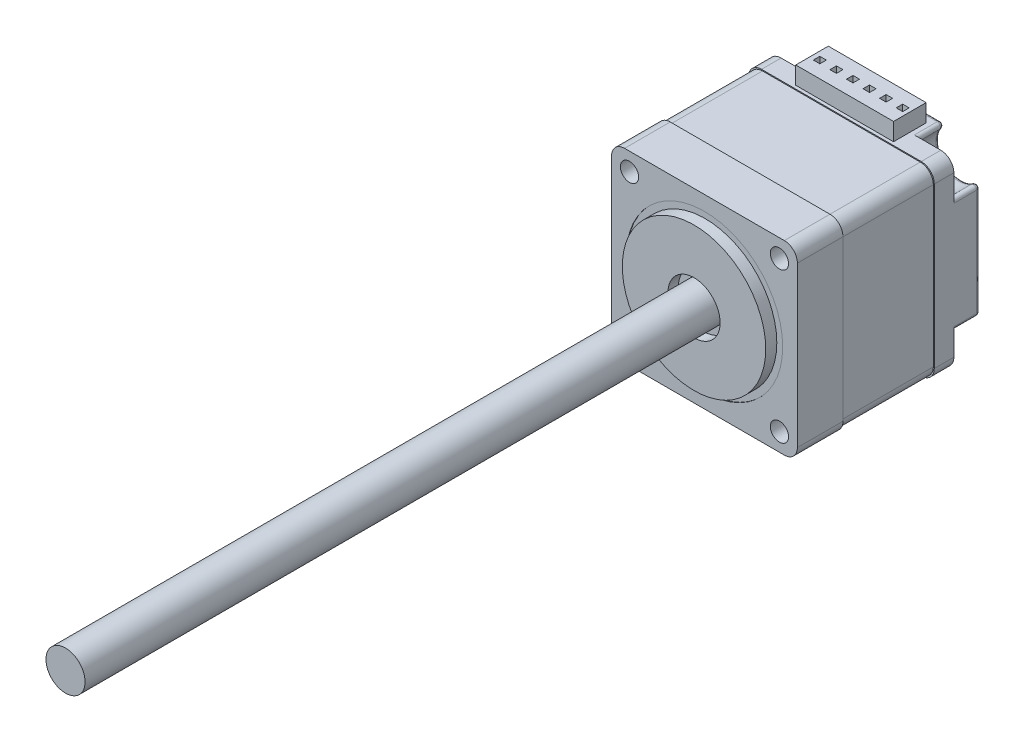
from build123d import *

# Parameters (mm, degrees)
SKETCH1_W           = 28.5
SKETCH1_H           = 28.5
BOSS_EXTRUDE1_DEPTH = 7
FILLET1_R           = 2
SKETCH2_R           = 11
BOSS_EXTRUDE2_DEPTH = 1.6
SKETCH3_R           = 4
CUT_EXTRUDE1_DEPTH  = 1.6
SKETCH6_W           = 28.2
SKETCH6_H           = 28.2
BOSS_EXTRUDE4_DEPTH = 14
FILLET2_R           = 2
SKETCH7_W           = 28.5
SKETCH7_H           = 28.5
BOSS_EXTRUDE5_DEPTH = 7
FILLET3_R           = 2
SKETCH8_W           = 15
SKETCH8_H           = 5
BOSS_EXTRUDE6_DEPTH = 2.7
SKETCH9_R           = 1.4
CUT_EXTRUDE3_DEPTH  = 42.7
SKETCH10_R          = 3.5
CUT_EXTRUDE4_DEPTH  = 4
FILLET4_R           = 0.5
FILLET5_R           = 0.5
CUT_EXTRUDE5_START  = -0.1
SKETCH11_R          = 12
SKETCH11_R_2        = 11
CUT_EXTRUDE5_DEPTH  = 0.1
CUT_EXTRUDE6_START  = -2.5
SKETCH12_R          = 4
CUT_EXTRUDE6_DEPTH  = 2.5
SKETCH13_R          = 2.5
BOSS_EXTRUDE7_DEPTH = 0.5
FILLET6_R           = 0.2
SKETCH14_W          = 1
SKETCH14_H          = 1
CUT_EXTRUDE7_DEPTH  = 5
SKETCH_1_R          = 3
SHAFT_DEPTH         = 98


with BuildPart() as part:
    # Sketch1 → Boss-Extrude1 (new body)
    with BuildSketch(Plane.XY):
        Rectangle(SKETCH1_W, SKETCH1_H)
    extrude(amount=BOSS_EXTRUDE1_DEPTH)

    # Fillet1
    fillet1_edges = [part.edges().sort_by_distance(p)[0] for p in [
        (14.25, -14.25, 3.5),
        (-14.25, -14.25, 3.5),
        (-14.25, 14.25, 3.5),
        (14.25, 14.25, 3.5),
    ]]
    fillet(fillet1_edges, radius=FILLET1_R)

    # Sketch2 → Boss-Extrude2 (add)
    with BuildSketch(Plane.XY.offset(7)):
        Circle(SKETCH2_R)
    extrude(amount=BOSS_EXTRUDE2_DEPTH)

    # Sketch3 → Cut-Extrude1 (cut)
    with BuildSketch(Plane.XY.offset(8.6)):
        Circle(SKETCH3_R)
    extrude(amount=-CUT_EXTRUDE1_DEPTH, mode=Mode.SUBTRACT)

    # Sketch6 → Boss-Extrude4 (add)
    with BuildSketch(Plane(origin=(0, 0, 0), x_dir=(-1, 0, 0), z_dir=(0, 0, -1))):
        Rectangle(SKETCH6_W, SKETCH6_H)
    extrude(amount=BOSS_EXTRUDE4_DEPTH)

    # Fillet2
    # the kernel refuses this fillet: 2 mm, written as the material it takes off along each edge
    with BuildSketch(Plane(origin=(-14.1, -14.1, 0), x_dir=(0, 1, 0), z_dir=(0, 0, -1)), Plane(origin=(-14.1, 14.1, 0), x_dir=(1, 0, 0), z_dir=(0, 0, -1))) as fillet2_piece_1:
        with BuildLine():
            CenterArc((FILLET2_R, FILLET2_R), FILLET2_R, 180, 90)
            Line((0, FILLET2_R), (0, 0))
            Line((0, 0), (FILLET2_R, 0))
        make_face()
    extrude(amount=19, mode=Mode.SUBTRACT)
    with BuildSketch(Plane(origin=(14.1, 14.1, 0), x_dir=(-1, 0, 0), z_dir=(0, 0, -1)), Plane(origin=(14.1, -14.1, 0), x_dir=(0, 1, 0), z_dir=(0, 0, -1))) as fillet2_piece_2:
        with BuildLine():
            CenterArc((FILLET2_R, -FILLET2_R), FILLET2_R, 90, 90)
            Line((0, -FILLET2_R), (0, 0))
            Line((0, 0), (FILLET2_R, 0))
        make_face()
    extrude(amount=19, mode=Mode.SUBTRACT)

    # Sketch7 → Boss-Extrude5 (add)
    with BuildSketch(Plane(origin=(0, 0, -14), x_dir=(-1, 0, 0), z_dir=(0, 0, -1))):
        Rectangle(SKETCH7_W, SKETCH7_H)
    extrude(amount=BOSS_EXTRUDE5_DEPTH)

    # Fillet3
    fillet3_edges = [part.edges().sort_by_distance(p)[0] for p in [
        (-14.25, -14.25, -17.5),
        (-14.25, 14.25, -17.5),
        (14.25, 14.25, -17.5),
        (14.25, -14.25, -17.5),
    ]]
    fillet(fillet3_edges, radius=FILLET3_R)

    # Sketch8 → Boss-Extrude6 (add)
    with BuildSketch(Plane(origin=(0, 14.25, 0), x_dir=(1, 0, 0), z_dir=(0, 1, 0))):
        with Locations((0, 17)):
            Rectangle(SKETCH8_W, SKETCH8_H)
    extrude(amount=BOSS_EXTRUDE6_DEPTH)

    # Sketch9 → Cut-Extrude3 (cut)
    with BuildSketch(Plane.XY.offset(7)):
        with Locations((-11.5, 11.5)):
            Circle(SKETCH9_R)
        with Locations((11.5, 11.5)):
            Circle(SKETCH9_R)
        with Locations((11.5, -11.5)):
            Circle(SKETCH9_R)
        with Locations((-11.5, -11.5)):
            Circle(SKETCH9_R)
    extrude(amount=-CUT_EXTRUDE3_DEPTH, mode=Mode.SUBTRACT)

    # Sketch10 → Cut-Extrude4 (cut)
    with BuildSketch(Plane(origin=(0, 0, -21), x_dir=(-1, 0, 0), z_dir=(0, 0, -1))):
        with Locations((-11.5, 11.5)):
            Circle(SKETCH10_R)
        with Locations((11.5, 11.5)):
            Circle(SKETCH10_R)
        with Locations((11.5, -11.5)):
            Circle(SKETCH10_R)
        with Locations((-11.5, -11.5)):
            Circle(SKETCH10_R)
    extrude(amount=-CUT_EXTRUDE4_DEPTH, mode=Mode.SUBTRACT)

    # Fillet4
    fillet4_edges = [part.edges().sort_by_distance(p)[0] for p in [
        (14.25, -9.334936491, -19),
        (9.334936491, -14.25, -19),
        (-14.25, -9.334936491, -19),
        (-9.334936491, -14.25, -19),
        (-9.334936491, 14.25, -19),
        (-14.25, 9.334936491, -19),
        (9.334936491, 14.25, -19),
        (14.25, 9.334936491, -19),
    ]]
    fillet(fillet4_edges, radius=FILLET4_R)

    # Fillet5
    fillet5_edges = [part.edges().sort_by_distance(p)[0] for p in [
        (-14.25, 0, -21),
        (9.025126266, -9.025126266, -21),
        (0, -14.25, -21),
        (-9.025126266, -9.025126266, -21),
        (-9.025126266, 9.025126266, -21),
        (0, 14.25, -21),
        (9.025126266, 9.025126266, -21),
        (14.25, 0, -21),
        (13.983853587, 8.634752599, -21),
        (8.634752599, 13.983853587, -21),
        (13.983853587, -8.634752599, -21),
        (8.634752599, -13.983853587, -21),
        (-8.634752599, -13.983853587, -21),
        (-13.983853587, -8.634752599, -21),
        (-8.634752599, 13.983853587, -21),
        (-13.983853587, 8.634752599, -21),
    ]]
    fillet(fillet5_edges, radius=FILLET5_R)

    # Sketch11 → Cut-Extrude5 (cut)
    with BuildSketch(Plane.XY.offset(7).offset(CUT_EXTRUDE5_START)):
        Circle(SKETCH11_R)
        Circle(SKETCH11_R_2, mode=Mode.SUBTRACT)
    extrude(amount=CUT_EXTRUDE5_DEPTH, mode=Mode.SUBTRACT)

    # Sketch12 → Cut-Extrude6 (cut)
    with BuildSketch(Plane(origin=(0, 0, -21), x_dir=(-1, 0, 0), z_dir=(0, 0, -1)).offset(CUT_EXTRUDE6_START)):
        with Locations(Location((0, 0, 0), (0, 0, 180))):
            Circle(SKETCH12_R)
    extrude(amount=CUT_EXTRUDE6_DEPTH, mode=Mode.SUBTRACT)

    # Sketch13 → Boss-Extrude7 (add)
    with BuildSketch(Plane(origin=(0, 0, -18.5), x_dir=(-1, 0, 0), z_dir=(0, 0, -1))):
        Circle(SKETCH13_R)
    extrude(amount=BOSS_EXTRUDE7_DEPTH)

    # Fillet6
    fillet6_edges = [part.edges().sort_by_distance(p)[0] for p in [
        (2.5, 0, -19),
    ]]
    fillet(fillet6_edges, radius=FILLET6_R)

    # Sketch14 → Cut-Extrude7 (cut)
    with BuildSketch(Plane(origin=(0, 16.95, 0), x_dir=(1, 0, 0), z_dir=(0, 1, 0))):
        with Locations((-6.3, 17)):
            Rectangle(SKETCH14_W, SKETCH14_H)
        with Locations((-3.76, 17)):
            Rectangle(SKETCH14_W, SKETCH14_H)
        with Locations((-1.22, 17)):
            Rectangle(SKETCH14_W, SKETCH14_H)
        with Locations((1.32, 17)):
            Rectangle(SKETCH14_W, SKETCH14_H)
        with Locations((3.86, 17)):
            Rectangle(SKETCH14_W, SKETCH14_H)
        with Locations((6.4, 17)):
            Rectangle(SKETCH14_W, SKETCH14_H)
    extrude(amount=-CUT_EXTRUDE7_DEPTH, mode=Mode.SUBTRACT)

    # Эскиз1 → Shaft (add)
    with BuildSketch(Plane.XY.offset(7)):
        Circle(SKETCH_1_R)
    extrude(amount=SHAFT_DEPTH)


solid = part.part
